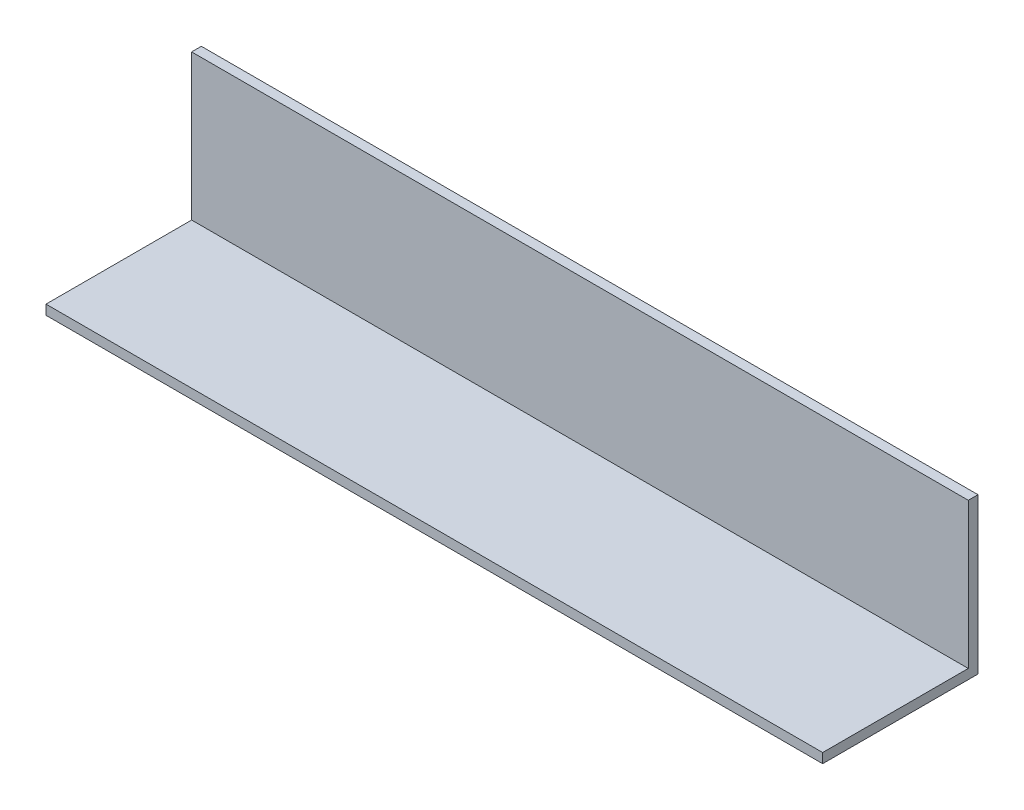
from build123d import *

# Parameters (mm, degrees)
BOSS_EXTRUDE1_DEPTH = 254


with BuildPart() as part:
    # Sketch1 → Boss-Extrude1 (new body)
    with BuildSketch(Plane(origin=(0, 0, 0), x_dir=(0, 0, -1), z_dir=(1, 0, 0))):
        Polygon((-3.175, 0), (-50.8, 0), (-50.8, -3.175), (0, -3.175), (0, 0), (0, 47.625), (-3.175, 47.625), align=None)
    extrude(amount=BOSS_EXTRUDE1_DEPTH)


solid = part.part
